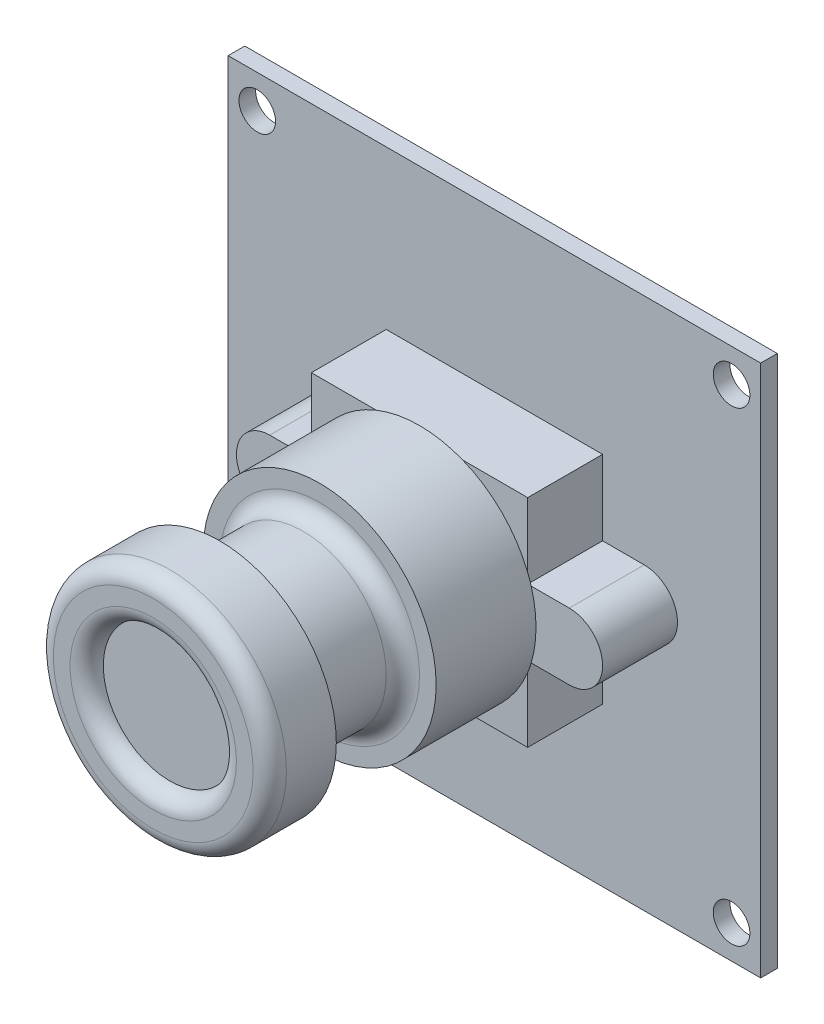
from build123d import *

# Parameters (mm, degrees)
SKETCH_2_W          = 32
SKETCH_2_H          = 32
SKETCH_2_R          = 1.1
EXTRUDE_1_DEPTH     = 1
EXTRUDE_2_DEPTH     = 4.5
SKETCH_4_R          = 7
EXTRUDE_3_DEPTH     = 6
SKETCH_5_R          = 5
EXTRUDE_4_DEPTH     = 6
SKETCH_6_R          = 7
EXTRUDE_5_DEPTH     = 4
SKETCH_9_R          = 4
CUT_EXTRUDE_2_DEPTH = 1
FILLET_2_R          = 1


with BuildPart() as part:
    # 草图2 → 凸台-拉伸1 (new body)
    with BuildSketch(Plane.XY):
        Rectangle(SKETCH_2_W, SKETCH_2_H)
        with Locations((-14.25, -14)):
            Circle(SKETCH_2_R, mode=Mode.SUBTRACT)
        with Locations((-14.25, 14)):
            Circle(SKETCH_2_R, mode=Mode.SUBTRACT)
        with Locations(Location((14.25, 14, 0), (0, 0, 180))):
            Circle(SKETCH_2_R, mode=Mode.SUBTRACT)
        with Locations(Location((14.25, -14, 0), (0, 0, 180))):
            Circle(SKETCH_2_R, mode=Mode.SUBTRACT)
    extrude(amount=EXTRUDE_1_DEPTH)

    # 草图3 → 凸台-拉伸2 (add)
    with BuildSketch(Plane.XY.offset(1)):
        with BuildLine():
            Line((-6.5, -6.5), (6.5, -6.5))
            Line((6.5, -6.5), (6.5, -2))
            Line((6.5, -2), (9, -2))
            ThreePointArc((9, -2), (11, 0), (9, 2))
            Line((9, 2), (6.5, 2))
            Line((6.5, 2), (6.5, 6.5))
            Line((6.5, 6.5), (-6.5, 6.5))
            Line((-6.5, 6.5), (-6.5, 2))
            Line((-6.5, 2), (-9, 2))
            ThreePointArc((-9, 2), (-11, 0), (-9, -2))
            Line((-9, -2), (-6.5, -2))
            Line((-6.5, -2), (-6.5, -6.5))
        make_face()
    extrude(amount=EXTRUDE_2_DEPTH)

    # 草图4 → 凸台-拉伸3 (add)
    with BuildSketch(Plane.XY.offset(5.5)):
        with Locations(Location((0, 0, 0), (0, 0, 196.601549599))):
            Circle(SKETCH_4_R)
    extrude(amount=EXTRUDE_3_DEPTH)

    # 草图5 → 凸台-拉伸4 (add)
    with BuildSketch(Plane.XY.offset(11.5)):
        Circle(SKETCH_5_R)
    extrude(amount=EXTRUDE_4_DEPTH)

    # 草图6 → 凸台-拉伸5 (add)
    with BuildSketch(Plane.XY.offset(17.5)):
        with Locations(Location((0, 0, 0), (0, 0, 196.601549599))):
            Circle(SKETCH_6_R)
    extrude(amount=EXTRUDE_5_DEPTH)

    # 草图9 → 切除-拉伸2 (cut)
    with BuildSketch(Plane.XY.offset(21.5)):
        Circle(SKETCH_9_R)
    extrude(amount=-CUT_EXTRUDE_2_DEPTH, mode=Mode.SUBTRACT)

    # 圆角2
    fillet_2_edges = [part.edges().sort_by_distance(p)[0] for p in [
        (-4, 0, 21.5),
        (-5, 0, 11.5),
        (-5, 0, 17.5),
        (6.708203933, 2, 21.5),
    ]]
    fillet(fillet_2_edges, radius=FILLET_2_R - 0.0001)  # a hair under: the kernel refuses the full size


solid = part.part
